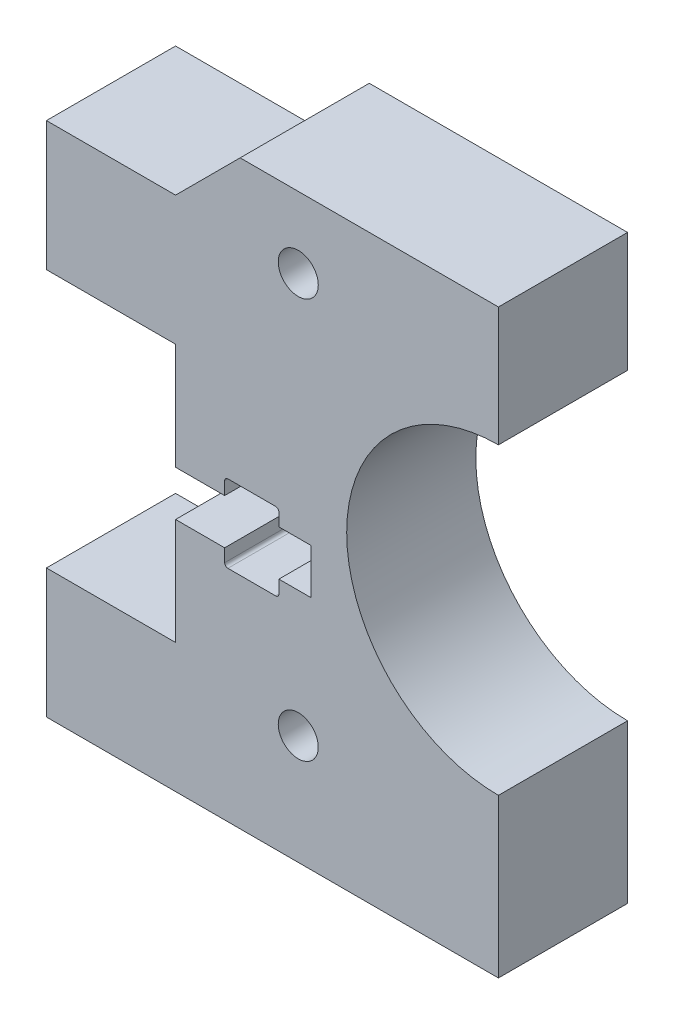
from build123d import *

# Parameters (mm, degrees)
BOSS_EXTRUDE1_DEPTH = 10
SKETCH2_R           = 11.75
SKETCH2_R_2         = 1.55
MOTOR_DEPTH         = 57.789083458
SCREW_DEPTH         = 57.789083458
SKETCH4_W           = 25
SKETCH4_H           = 5
CUT_EXTRUDE3_DEPTH  = 57.789083458


with BuildPart() as part:
    # Sketch1 → Boss-Extrude1 (new body)
    with BuildSketch(Plane.XY):
        Polygon((0, 0), (0, -5), (-10, -5), (-10, -15), (0, -15), (0, -35), (-10, -35), (-10, -45), (0, -45), (0, -50), (25, -50), (25, 0), align=None)
    extrude(amount=BOSS_EXTRUDE1_DEPTH)

    # Sketch2 → motor (cut, through all)
    with BuildSketch(Plane.XY.offset(10)):
        with Locations((25, -21)):
            Circle(SKETCH2_R)
        with Locations((9.5, -5.5)):
            Circle(SKETCH2_R_2)
        with Locations((9.5, -36.5)):
            Circle(SKETCH2_R_2)
    extrude(amount=-MOTOR_DEPTH, mode=Mode.SUBTRACT)

    # Sketch3 → screw (cut, through all)
    with BuildSketch(Plane.XY.offset(10)):
        with BuildLine():
            Line((0, -26.75), (0, -23.25))
            Line((0, -23.25), (3.8, -23.25))
            Line((3.8, -23.25), (3.8, -22.25))
            ThreePointArc((3.8, -22.25), (3.873223305, -22.073223305), (4.05, -22))
            Line((4.05, -22), (7.75, -22))
            ThreePointArc((7.75, -22), (7.926776695, -22.073223305), (8, -22.25))
            Line((8, -22.25), (8, -23.25))
            Line((8, -23.25), (10.5, -23.25))
            Line((10.5, -23.25), (10.5, -26.75))
            Line((10.5, -26.75), (8, -26.75))
            Line((8, -26.75), (8, -27.75))
            ThreePointArc((8, -27.75), (7.926776695, -27.926776695), (7.75, -28))
            Line((7.75, -28), (4.05, -28))
            ThreePointArc((4.05, -28), (3.873223305, -27.926776695), (3.8, -27.75))
            Line((3.8, -27.75), (3.8, -26.75))
            Line((3.8, -26.75), (0, -26.75))
        make_face()
    extrude(amount=-SCREW_DEPTH, mode=Mode.SUBTRACT)

    # Sketch4 → Cut-Extrude3 (cut, through all)
    with BuildSketch(Plane.XY.offset(10)):
        with Locations((12.5, -47.5)):
            Rectangle(SKETCH4_W, SKETCH4_H)
        Polygon((0, -5), (5, 0), (0, 0), align=None)
    extrude(amount=-CUT_EXTRUDE3_DEPTH, mode=Mode.SUBTRACT)


solid = part.part
